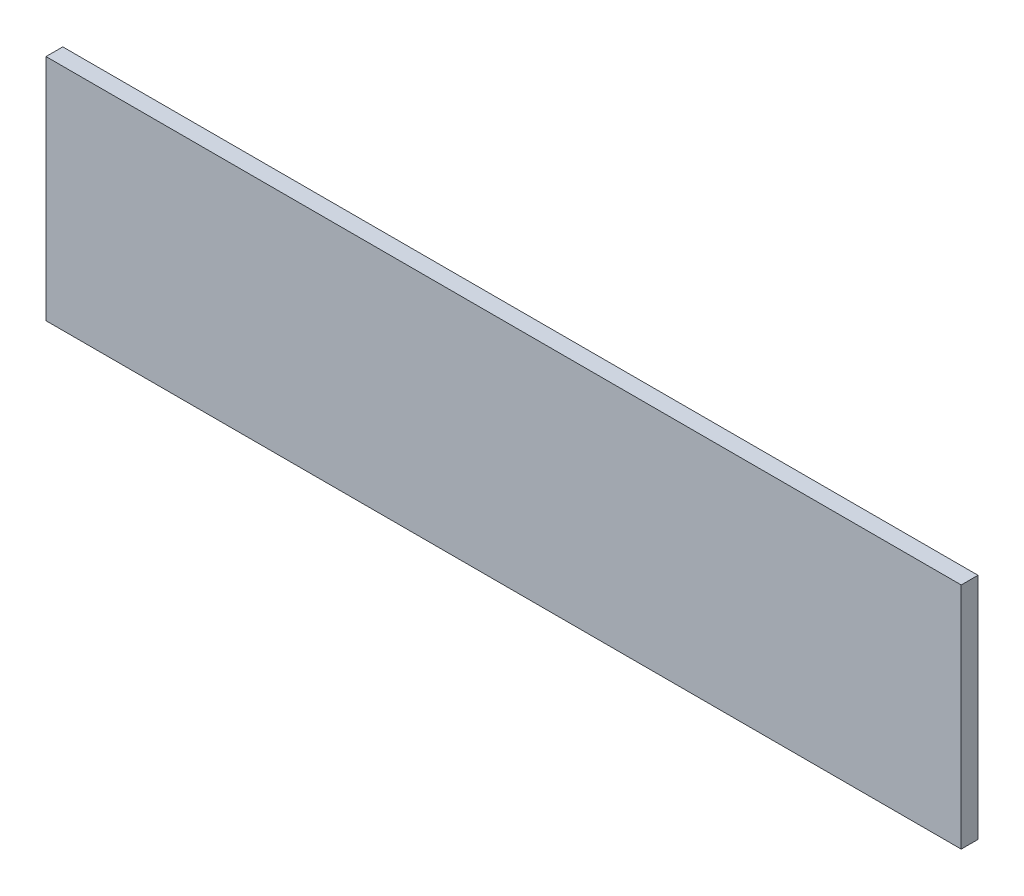
from build123d import *

# Parameters (mm, degrees)
SKETCH1_W           = 304.8
SKETCH1_H           = 76.2
BOSS_EXTRUDE1_DEPTH = 5.588


with BuildPart() as part:
    # Sketch1 → Boss-Extrude1 (new body)
    with BuildSketch(Plane.XY):
        Rectangle(SKETCH1_W, SKETCH1_H)
    extrude(amount=BOSS_EXTRUDE1_DEPTH)


solid = part.part
